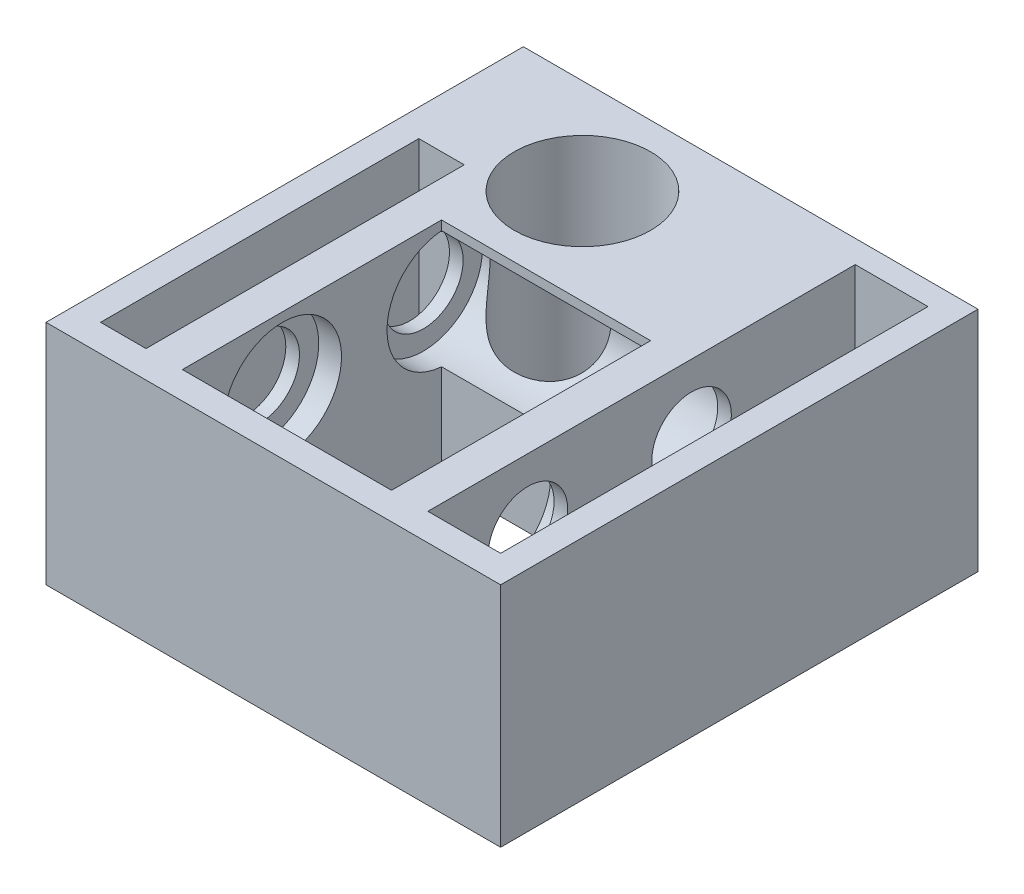
from build123d import *

# Parameters (mm, degrees)
SKETCH2_W           = 100
SKETCH2_H           = 105
BOSS_EXTRUDE1_DEPTH = 50
CUT_EXTRUDE1_REACH  = 90.07
SKETCH3_R           = 15
CUT_EXTRUDE3_REACH  = 90.07
SKETCH5_W           = 16
SKETCH5_H           = 80
SKETCH5_W_2         = 10
SKETCH5_H_2         = 70
SKETCH6_R           = 13
CUT_EXTRUDE4_DEPTH  = 31
SKETCH7_R           = 13
SKETCH7_R_2         = 8.75
BOSS_EXTRUDE2_DEPTH = 3
CUT_EXTRUDE7_REACH  = 90.07
SKETCH11_W          = 16
SKETCH11_H          = 14
CUT_EXTRUDE5_REACH  = 90.07
SKETCH8_W           = 46
SKETCH8_H           = 57
SKETCH9_R           = 1.6
CUT_EXTRUDE8_DEPTH  = 3
SKETCH10_W          = 20
SKETCH10_H          = 18
CUT_EXTRUDE9_DEPTH  = 22


with BuildPart() as part:
    # Sketch2 → Boss-Extrude1 (new body)
    with BuildSketch(Plane(origin=(0, 0, 0), x_dir=(1, 0, 0), z_dir=(0, 1, 0))):
        Rectangle(SKETCH2_W, SKETCH2_H)
    extrude(amount=BOSS_EXTRUDE1_DEPTH)

    # Sketch3 → Cut-Extrude1 (cut, up to next)
    with BuildSketch(Plane(origin=(0, 50, 0), x_dir=(1, 0, 0), z_dir=(0, 1, 0)), mode=Mode.PRIVATE) as cut_extrude1_sk1:
        with Locations((-16.005435425, 31.5)):
            Circle(SKETCH3_R)
    cut_extrude1_tool1 = extrude(cut_extrude1_sk1.sketch, amount=-CUT_EXTRUDE1_REACH, mode=Mode.PRIVATE) & part.part
    add(cut_extrude1_tool1.solids().sort_by_distance((-16.005435, 50, -31.5))[0], mode=Mode.SUBTRACT)

    # Sketch5 → Cut-Extrude3 (cut, up to next)
    with BuildSketch(Plane(origin=(0, 50, 0), x_dir=(1, 0, 0), z_dir=(0, 1, 0)), mode=Mode.PRIVATE) as cut_extrude3_sk1:
        with Locations((36, -6.5)):
            Rectangle(SKETCH5_W, SKETCH5_H)
    cut_extrude3_tool1 = extrude(cut_extrude3_sk1.sketch, amount=-CUT_EXTRUDE3_REACH, mode=Mode.PRIVATE) & part.part
    # Sketch5 → Cut-Extrude3 (cut, up to next)
    with BuildSketch(Plane(origin=(0, 50, 0), x_dir=(1, 0, 0), z_dir=(0, 1, 0)), mode=Mode.PRIVATE) as cut_extrude3_sk2:
        with Locations((-39, -11.5)):
            Rectangle(SKETCH5_W_2, SKETCH5_H_2)
    cut_extrude3_tool2 = extrude(cut_extrude3_sk2.sketch, amount=-CUT_EXTRUDE3_REACH, mode=Mode.PRIVATE) & part.part
    add(cut_extrude3_tool1.solids().sort_by_distance((36, 50, 6.5))[0], mode=Mode.SUBTRACT)
    add(cut_extrude3_tool2.solids().sort_by_distance((-39, 50, 11.5))[0], mode=Mode.SUBTRACT)

    # Sketch6 → Cut-Extrude4 (cut)
    with BuildSketch(Plane(origin=(28, 0, 0), x_dir=(0, 0, -1), z_dir=(1, 0, 0))):
        with Locations((-24.5, 35)):
            Circle(SKETCH6_R)
        with Locations((11.5, 35)):
            Circle(SKETCH6_R)
    cut_extrude4 = extrude(amount=-CUT_EXTRUDE4_DEPTH, mode=Mode.SUBTRACT)

    # Sketch7 → Boss-Extrude2 (add)
    # profile 1 of 2: a face of its own
    with BuildSketch(Plane(origin=(28, 0, 0), x_dir=(0, 0, -1), z_dir=(1, 0, 0))):
        with Locations((11.5, 35)):
            Circle(SKETCH7_R)
        with Locations((11.5, 35)):
            Circle(SKETCH7_R_2, mode=Mode.SUBTRACT)
    # profile 2 of 2: a face of its own
    with BuildSketch(Plane(origin=(28, 0, 0), x_dir=(0, 0, -1), z_dir=(1, 0, 0))):
        with Locations((-24.5, 35)):
            Circle(SKETCH7_R)
        with Locations((-24.5, 35)):
            Circle(SKETCH7_R_2, mode=Mode.SUBTRACT)
    boss_extrude2 = extrude(amount=-BOSS_EXTRUDE2_DEPTH)

    # Mirror1: Cut-Extrude4, Boss-Extrude2 across plane
    add(cut_extrude4.mirror(Plane(origin=(-3, 0, 0), x_dir=(0, 0, 1), z_dir=(1, 0, 0))), mode=Mode.SUBTRACT)
    add(boss_extrude2.mirror(Plane(origin=(-3, 0, 0), x_dir=(0, 0, 1), z_dir=(1, 0, 0))))

    # Sketch11 → Cut-Extrude7 (cut, up to next)
    with BuildSketch(Plane(origin=(0, 50, 0), x_dir=(1, 0, 0), z_dir=(0, 1, 0)), mode=Mode.PRIVATE) as cut_extrude7_sk1:
        with Locations((36, 40.5)):
            Rectangle(SKETCH11_W, SKETCH11_H)
    cut_extrude7_tool1 = extrude(cut_extrude7_sk1.sketch, amount=-CUT_EXTRUDE7_REACH, mode=Mode.PRIVATE) & part.part
    add(cut_extrude7_tool1.solids().sort_by_distance((36, 50, -40.5))[0], mode=Mode.SUBTRACT)

    # Sketch8 → Cut-Extrude5 (cut, up to next)
    with BuildSketch(Plane(origin=(0, 50, 0), x_dir=(1, 0, 0), z_dir=(0, 1, 0)), mode=Mode.PRIVATE) as cut_extrude5_sk1:
        with Locations((-3, -18)):
            Rectangle(SKETCH8_W, SKETCH8_H)
    cut_extrude5_tool1 = extrude(cut_extrude5_sk1.sketch, amount=-CUT_EXTRUDE5_REACH, mode=Mode.PRIVATE) & part.part
    add(cut_extrude5_tool1.solids().sort_by_distance((-3, 50, 18))[0], mode=Mode.SUBTRACT)

    # Sketch9 → Cut-Extrude8 (cut)
    with BuildSketch(Plane(origin=(28, 0, 0), x_dir=(0, 0, -1), z_dir=(1, 0, 0))):
        with Locations((35.5, 17)):
            Circle(SKETCH9_R)
    extrude(amount=-CUT_EXTRUDE8_DEPTH, mode=Mode.SUBTRACT)

    # Sketch10 → Cut-Extrude9 (cut)
    with BuildSketch(Plane.XZ):
        with Locations((15, -38.5)):
            Rectangle(SKETCH10_W, SKETCH10_H)
    extrude(amount=-CUT_EXTRUDE9_DEPTH, mode=Mode.SUBTRACT)


solid = part.part
